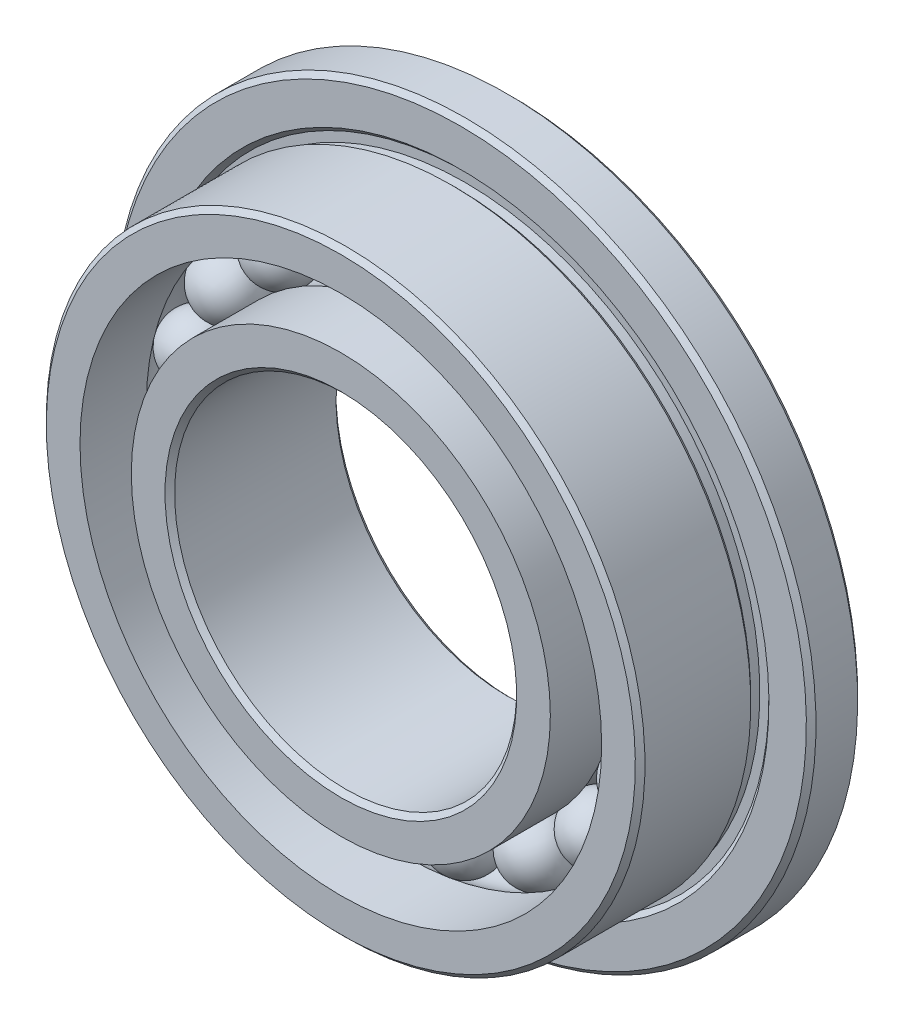
from build123d import *

# Parameters (mm, degrees)
FILLET1_SIZE      = 0.05625
FILLET2_SIZE      = 0.05625
CIRPATTERN3_COUNT = 19


with BuildPart() as part:
    # Sketch2 → Revolve1 (revolve)
    with BuildSketch(Plane(origin=(0, 0, 0), x_dir=(0, 0, -1), z_dir=(1, 0, 0))):
        with BuildLine():
            Line((1, 4.1), (0.4, 4.1))
            Line((0.4, 4.1), (0.4, 3.606066017))
            Line((0.4, 3.606066017), (0.453033009, 3.553033009))
            Line((0.453033009, 3.553033009), (0.453033009, 3.446966991))
            Line((0.453033009, 3.446966991), (0.346966991, 3.446966991))
            Line((0.346966991, 3.446966991), (0.293933983, 3.5))
            Line((0.293933983, 3.5), (-1, 3.5))
            Line((-1, 3.5), (-1, 3.05))
            Line((-1, 3.05), (-0.225, 3.05))
            ThreePointArc((-0.225, 3.05), (0, 3.125), (0.225, 3.05))
            Line((0.225, 3.05), (1, 3.05))
            Line((1, 3.05), (1, 4.1))
        make_face()
        with BuildLine():
            Line((1, 2), (-1, 2))
            Line((-1, 2), (-1, 2.45))
            Line((-1, 2.45), (-0.225, 2.45))
            ThreePointArc((-0.225, 2.45), (0, 2.375), (0.225, 2.45))
            Line((0.225, 2.45), (1, 2.45))
            Line((1, 2.45), (1, 2))
        make_face()
    revolve(axis=Axis((0, 0, 0), (0, 0, -1)))

    # Fillet1
    fillet1_edges = [part.edges().sort_by_distance(p)[0] for p in [
        (0, -4.1, -1),
        (0, -4.1, -0.4),
        (0, -3.5, 1),
    ]]
    chamfer(fillet1_edges, length=FILLET1_SIZE)

    # Fillet2
    fillet2_edges = [part.edges().sort_by_distance(p)[0] for p in [
        (0, -2, -1),
        (0, -2, 1),
    ]]
    chamfer(fillet2_edges, length=FILLET2_SIZE)


with BuildPart() as body_2:
    # Sketch7 → Revolve3 (revolve)
    with BuildSketch(Plane.XY):
        with BuildLine():
            Line((0, 3.125), (0, 2.375))
            ThreePointArc((0, 2.375), (-0.375, 2.75), (0, 3.125))
        make_face()
    revolve(axis=Axis((0, 3.125, 0), (0, -1, 0)))


with BuildPart() as cirpattern3_1:
    # CirPattern3: pattern copy
    add(body_2.part.rotate(Axis((0, 0, 0), (0, 0, -1)), 1 * 360 / CIRPATTERN3_COUNT))


with BuildPart() as cirpattern3_2:
    # CirPattern3: pattern copy
    add(body_2.part.rotate(Axis((0, 0, 0), (0, 0, -1)), 2 * 360 / CIRPATTERN3_COUNT))


with BuildPart() as cirpattern3_3:
    # CirPattern3: pattern copy
    add(body_2.part.rotate(Axis((0, 0, 0), (0, 0, -1)), 3 * 360 / CIRPATTERN3_COUNT))


with BuildPart() as cirpattern3_4:
    # CirPattern3: pattern copy
    add(body_2.part.rotate(Axis((0, 0, 0), (0, 0, -1)), 4 * 360 / CIRPATTERN3_COUNT))


with BuildPart() as cirpattern3_5:
    # CirPattern3: pattern copy
    add(body_2.part.rotate(Axis((0, 0, 0), (0, 0, -1)), 5 * 360 / CIRPATTERN3_COUNT))


with BuildPart() as cirpattern3_6:
    # CirPattern3: pattern copy
    add(body_2.part.rotate(Axis((0, 0, 0), (0, 0, -1)), 6 * 360 / CIRPATTERN3_COUNT))


with BuildPart() as cirpattern3_7:
    # CirPattern3: pattern copy
    add(body_2.part.rotate(Axis((0, 0, 0), (0, 0, -1)), 7 * 360 / CIRPATTERN3_COUNT))


with BuildPart() as cirpattern3_8:
    # CirPattern3: pattern copy
    add(body_2.part.rotate(Axis((0, 0, 0), (0, 0, -1)), 8 * 360 / CIRPATTERN3_COUNT))


with BuildPart() as cirpattern3_9:
    # CirPattern3: pattern copy
    add(body_2.part.rotate(Axis((0, 0, 0), (0, 0, -1)), 9 * 360 / CIRPATTERN3_COUNT))


with BuildPart() as cirpattern3_10:
    # CirPattern3: pattern copy
    add(body_2.part.rotate(Axis((0, 0, 0), (0, 0, -1)), 10 * 360 / CIRPATTERN3_COUNT))


with BuildPart() as cirpattern3_11:
    # CirPattern3: pattern copy
    add(body_2.part.rotate(Axis((0, 0, 0), (0, 0, -1)), 11 * 360 / CIRPATTERN3_COUNT))


with BuildPart() as cirpattern3_12:
    # CirPattern3: pattern copy
    add(body_2.part.rotate(Axis((0, 0, 0), (0, 0, -1)), 12 * 360 / CIRPATTERN3_COUNT))


with BuildPart() as cirpattern3_13:
    # CirPattern3: pattern copy
    add(body_2.part.rotate(Axis((0, 0, 0), (0, 0, -1)), 13 * 360 / CIRPATTERN3_COUNT))


with BuildPart() as cirpattern3_14:
    # CirPattern3: pattern copy
    add(body_2.part.rotate(Axis((0, 0, 0), (0, 0, -1)), 14 * 360 / CIRPATTERN3_COUNT))


with BuildPart() as cirpattern3_15:
    # CirPattern3: pattern copy
    add(body_2.part.rotate(Axis((0, 0, 0), (0, 0, -1)), 15 * 360 / CIRPATTERN3_COUNT))


with BuildPart() as cirpattern3_16:
    # CirPattern3: pattern copy
    add(body_2.part.rotate(Axis((0, 0, 0), (0, 0, -1)), 16 * 360 / CIRPATTERN3_COUNT))


with BuildPart() as cirpattern3_17:
    # CirPattern3: pattern copy
    add(body_2.part.rotate(Axis((0, 0, 0), (0, 0, -1)), 17 * 360 / CIRPATTERN3_COUNT))


with BuildPart() as cirpattern3_18:
    # CirPattern3: pattern copy
    add(body_2.part.rotate(Axis((0, 0, 0), (0, 0, -1)), 18 * 360 / CIRPATTERN3_COUNT))


solid = Compound([part.part, body_2.part, cirpattern3_1.part, cirpattern3_2.part, cirpattern3_3.part, cirpattern3_4.part, cirpattern3_5.part, cirpattern3_6.part, cirpattern3_7.part, cirpattern3_8.part, cirpattern3_9.part, cirpattern3_10.part, cirpattern3_11.part, cirpattern3_12.part, cirpattern3_13.part, cirpattern3_14.part, cirpattern3_15.part, cirpattern3_16.part, cirpattern3_17.part, cirpattern3_18.part])
